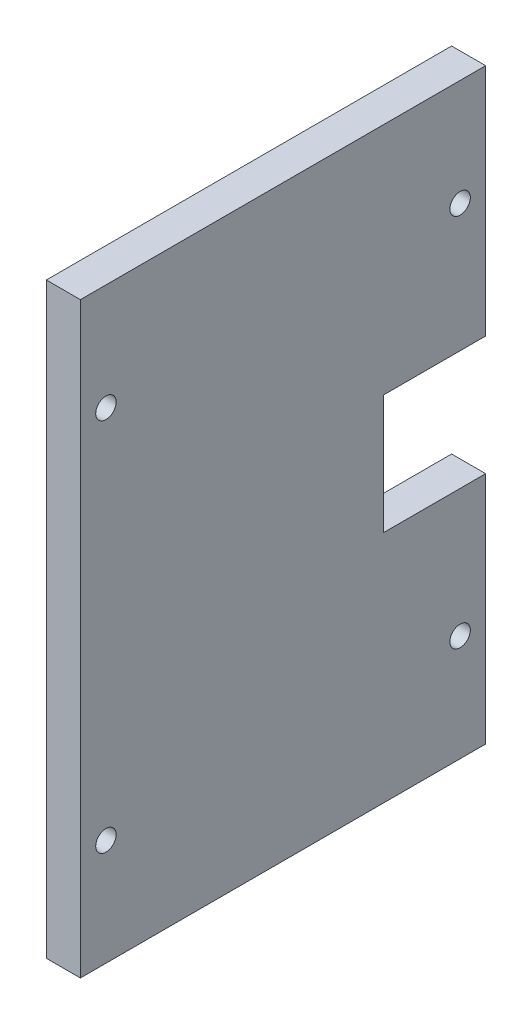
from build123d import *

# Parameters (mm, degrees)
S_BOX1_W       = 4
S_BOX1_H       = 69
BOSS_1_DEPTH   = 47.6
S_CUT2_W       = 4.2
S_CUT2_H       = 14
POCKET_2_DEPTH = 12.1
S_HOLE3_R      = 1.2
HOLE_3_DEPTH   = 4.2
S_HOLE4_R      = 2.3
HOLE_4_DEPTH   = 1.4
S_HOLE5_R      = 1.2
HOLE_5_DEPTH   = 4.2
S_HOLE6_R      = 2.3
HOLE_6_DEPTH   = 1.4
S_HOLE7_R      = 1.2
HOLE_7_DEPTH   = 4.2
S_HOLE8_R      = 2.3
HOLE_8_DEPTH   = 1.4
S_HOLE9_R      = 1.2
HOLE_9_DEPTH   = 4.2
S_HOLE10_R     = 2.3
HOLE_10_DEPTH  = 1.4


with BuildPart() as part:
    # S_box1 → Boss_1 (new body)
    with BuildSketch(Plane.XY.offset(126.2)):
        with Locations((12.2, 0)):
            Rectangle(S_BOX1_W, S_BOX1_H)
    extrude(amount=BOSS_1_DEPTH)

    # S_cut2 → Pocket_2 (cut)
    with BuildSketch(Plane.XY.offset(126.1)):
        with Locations((12.2, 0)):
            Rectangle(S_CUT2_W, S_CUT2_H)
    extrude(amount=POCKET_2_DEPTH, mode=Mode.SUBTRACT)

    # S_hole3 → Hole_3 (cut)
    with BuildSketch(Plane(origin=(10.1, 0, 0), x_dir=(0, 0, -1), z_dir=(1, 0, 0))):
        with Locations((-129.2, -22)):
            Circle(S_HOLE3_R)
    extrude(amount=HOLE_3_DEPTH, mode=Mode.SUBTRACT)

    # S_hole4 → Hole_4 (cut)
    with BuildSketch(Plane(origin=(10.1, 0, 0), x_dir=(0, 0, -1), z_dir=(1, 0, 0))):
        with Locations((-129.2, -22)):
            Circle(S_HOLE4_R)
    extrude(amount=HOLE_4_DEPTH, mode=Mode.SUBTRACT)

    # S_hole5 → Hole_5 (cut)
    with BuildSketch(Plane(origin=(10.1, 0, 0), x_dir=(0, 0, -1), z_dir=(1, 0, 0))):
        with Locations((-170.8, -22)):
            Circle(S_HOLE5_R)
    extrude(amount=HOLE_5_DEPTH, mode=Mode.SUBTRACT)

    # S_hole6 → Hole_6 (cut)
    with BuildSketch(Plane(origin=(10.1, 0, 0), x_dir=(0, 0, -1), z_dir=(1, 0, 0))):
        with Locations((-170.8, -22)):
            Circle(S_HOLE6_R)
    extrude(amount=HOLE_6_DEPTH, mode=Mode.SUBTRACT)

    # S_hole7 → Hole_7 (cut)
    with BuildSketch(Plane(origin=(10.1, 0, 0), x_dir=(0, 0, -1), z_dir=(1, 0, 0))):
        with Locations((-129.2, 22)):
            Circle(S_HOLE7_R)
    extrude(amount=HOLE_7_DEPTH, mode=Mode.SUBTRACT)

    # S_hole8 → Hole_8 (cut)
    with BuildSketch(Plane(origin=(10.1, 0, 0), x_dir=(0, 0, -1), z_dir=(1, 0, 0))):
        with Locations((-129.2, 22)):
            Circle(S_HOLE8_R)
    extrude(amount=HOLE_8_DEPTH, mode=Mode.SUBTRACT)

    # S_hole9 → Hole_9 (cut)
    with BuildSketch(Plane(origin=(10.1, 0, 0), x_dir=(0, 0, -1), z_dir=(1, 0, 0))):
        with Locations((-170.8, 22)):
            Circle(S_HOLE9_R)
    extrude(amount=HOLE_9_DEPTH, mode=Mode.SUBTRACT)

    # S_hole10 → Hole_10 (cut)
    with BuildSketch(Plane(origin=(10.1, 0, 0), x_dir=(0, 0, -1), z_dir=(1, 0, 0))):
        with Locations((-170.8, 22)):
            Circle(S_HOLE10_R)
    extrude(amount=HOLE_10_DEPTH, mode=Mode.SUBTRACT)


solid = part.part
